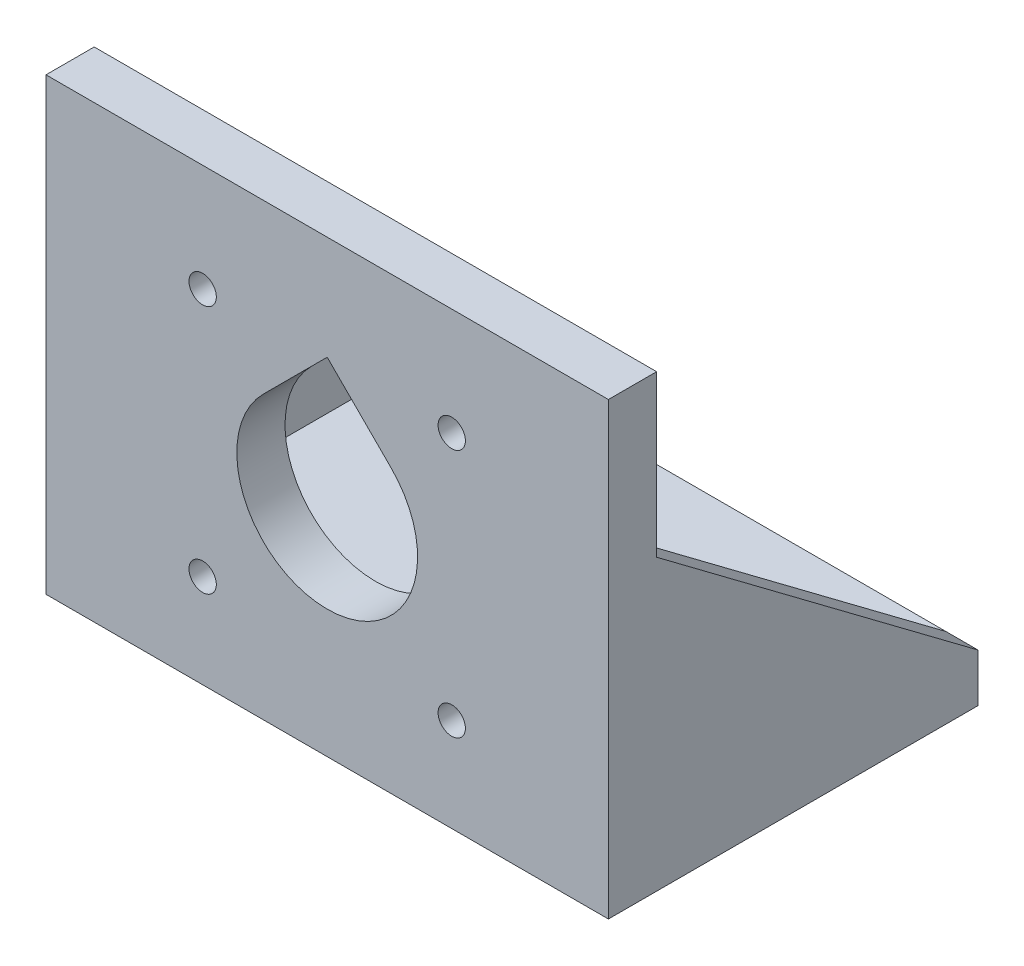
from build123d import *

# Parameters (mm, degrees)
SKETCH_01_W                   = 70
SKETCH_01_H                   = 56
EXTRUDE_01_DEPTH              = 6
SKETCH_02_W                   = 70
SKETCH_02_H                   = 46
EXTRUDE_02_DEPTH              = 6
EXTRUDE_03_DEPTH              = 4
EXTRUDE_START                 = 66
EXTRUDE_04_DEPTH              = 4
CUT_EXTRUDE_05_4_3_DEPTH      = 99.163129534
CUT_EXTRUDE_05_4_3_DEPTH_BACK = 99.163129534
SKETCH_05_R                   = 11.25
SKETCH_05_R_2                 = 1.7
CUT_EXTRUDE_06_DEPTH          = 99.163129534
CUT_EXTRUDE_06_DEPTH_BACK     = 99.163129534
CUT_EXTRUDE_07_4_4_DEPTH      = 99.163129534
CUT_EXTRUDE_07_4_4_DEPTH_BACK = 99.163129534
SKETCH_07_R                   = 2.25


with BuildPart() as part:
    # 01_Пластина_эскиз → 01_Передняя_пластина (new body)
    with BuildSketch(Plane.XY):
        with Locations((35, 28)):
            Rectangle(SKETCH_01_W, SKETCH_01_H)
    extrude(amount=EXTRUDE_01_DEPTH)

    # 02_Полка_эскиз → 02_Полка (add)
    with BuildSketch(Plane(origin=(0, 0, 0), x_dir=(1, 0, 0), z_dir=(0, 1, 0))):
        with Locations((35, 17)):
            Rectangle(SKETCH_02_W, SKETCH_02_H)
    extrude(amount=EXTRUDE_02_DEPTH)

    # 03_Косынка_левая_эскиз → 03_Косынка_левая (add)
    with BuildSketch(Plane(origin=(0, 0, 0), x_dir=(0, 0, -1), z_dir=(1, 0, 0))):
        Polygon((40, 6), (0, 6), (0, 36), align=None)
    extrude(amount=EXTRUDE_03_DEPTH)

    # 04_Косынка_правая_эскиз → 04_Косынка_правая (add)
    with BuildSketch(Plane(origin=(0, 0, 0), x_dir=(0, 0, -1), z_dir=(1, 0, 0)).offset(EXTRUDE_START)):
        Polygon((40, 6), (0, 6), (0, 36), align=None)
    extrude(amount=EXTRUDE_04_DEPTH)

    # 05_Мотор_передний_фланец_эскиз → 05_Буртик_и_4_отверстия_М3 (cut, two sides: drawn at the far end of the back side and taken through both)
    with BuildSketch(Plane.XY.offset(-CUT_EXTRUDE_05_4_3_DEPTH_BACK)):
        with Locations((35, 27.15)):
            Circle(SKETCH_05_R)
        with Locations((19.5, 11.65)):
            Circle(SKETCH_05_R_2)
        with Locations((19.5, 42.65)):
            Circle(SKETCH_05_R_2)
        with Locations((50.5, 11.65)):
            Circle(SKETCH_05_R_2)
        with Locations((50.5, 42.65)):
            Circle(SKETCH_05_R_2)
    extrude(amount=CUT_EXTRUDE_05_4_3_DEPTH + CUT_EXTRUDE_05_4_3_DEPTH_BACK, mode=Mode.SUBTRACT)

    # 06_Свод_45град_эскиз → 06_Свод_отверстия_для_печати (cut, two sides: drawn at the far end of the back side and taken through both)
    with BuildSketch(Plane.XY.offset(-CUT_EXTRUDE_06_DEPTH_BACK)):
        Polygon((27.045048712, 35.104951288), (42.954951288, 35.104951288), (35, 43.059902577), align=None)
    extrude(amount=CUT_EXTRUDE_06_DEPTH + CUT_EXTRUDE_06_DEPTH_BACK, mode=Mode.SUBTRACT)

    # 07_Крепление_полки_эскиз → 07_4_отверстия_М4 (cut, two sides: drawn at the far end of the back side and taken through both)
    with BuildSketch(Plane(origin=(0, 0, 0), x_dir=(1, 0, 0), z_dir=(0, 1, 0)).offset(-CUT_EXTRUDE_07_4_4_DEPTH_BACK)):
        with Locations((8.5, 12)):
            Circle(SKETCH_07_R)
        with Locations((8.5, 30)):
            Circle(SKETCH_07_R)
        with Locations((61.5, 12)):
            Circle(SKETCH_07_R)
        with Locations((61.5, 30)):
            Circle(SKETCH_07_R)
    extrude(amount=CUT_EXTRUDE_07_4_4_DEPTH + CUT_EXTRUDE_07_4_4_DEPTH_BACK, mode=Mode.SUBTRACT)


solid = part.part
